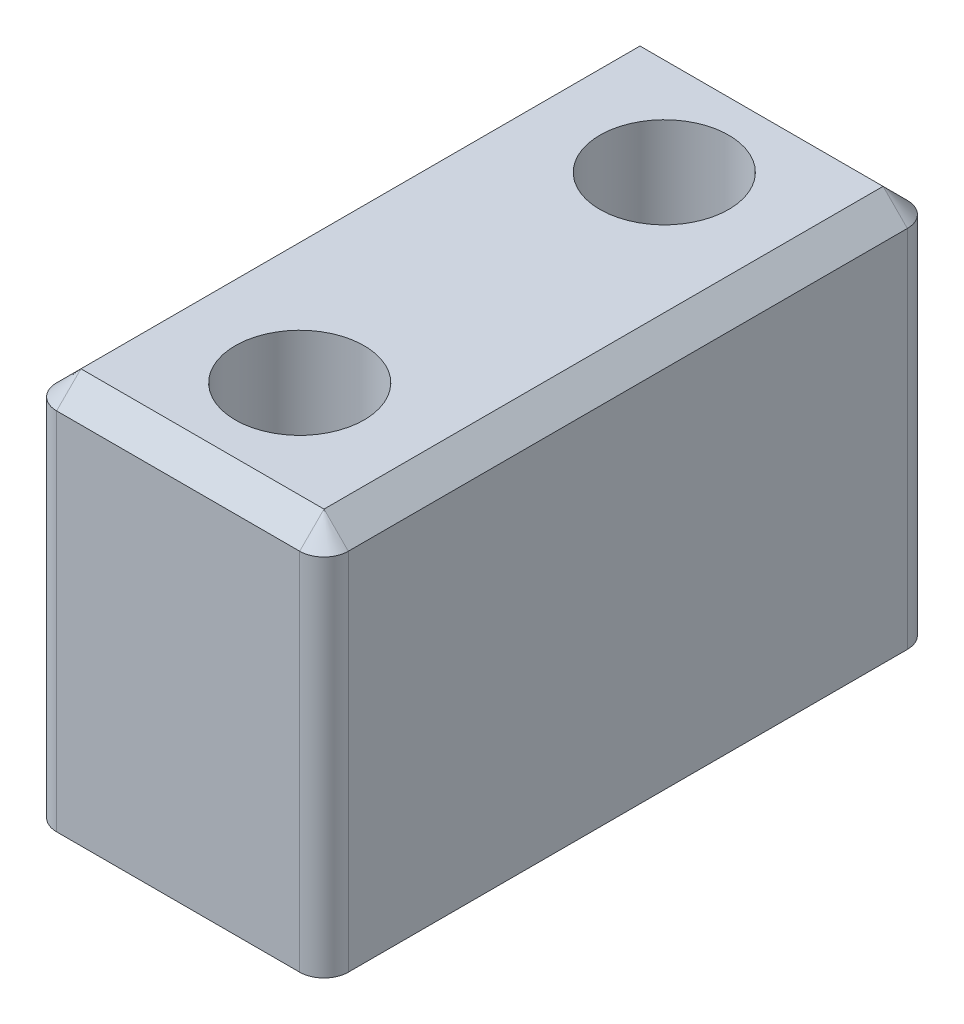
from build123d import *

# Parameters (mm, degrees)
SKETCH1_W           = 12
SKETCH1_H           = 25
SKETCH1_R           = 2.65
BOSS_EXTRUDE1_DEPTH = 8
FILLET1_R           = 1
CHAMFER1_SIZE       = 1


with BuildPart() as part:
    # Sketch1 → Boss-Extrude1 (new, symmetric)
    with BuildSketch(Plane(origin=(0, 0, 0), x_dir=(1, 0, 0), z_dir=(0, 1, 0))):
        Rectangle(SKETCH1_W, SKETCH1_H)
        with Locations((0, 7.5)):
            Circle(SKETCH1_R, mode=Mode.SUBTRACT)
        with Locations((0, -7.5)):
            Circle(SKETCH1_R, mode=Mode.SUBTRACT)
    extrude(amount=BOSS_EXTRUDE1_DEPTH, both=True)

    # Fillet1
    fillet1_edges = [part.edges().sort_by_distance(p)[0] for p in [
        (-6, 0, 12.5),
        (-6, 0, -12.5),
        (6, 0, -12.5),
        (6, 0, 12.5),
    ]]
    fillet(fillet1_edges, radius=FILLET1_R)

    # Chamfer1
    chamfer1_edges = [part.edges().sort_by_distance(p)[0] for p in [
        (0, 8, -12.5),
        (-5.707106781, 8, -12.207106781),
        (5.707106781, 8, -12.207106781),
        (-6, 8, 0),
        (6, 8, 0),
        (-5.707106781, 8, 12.207106781),
        (5.707106781, 8, 12.207106781),
        (0, 8, 12.5),
    ]]
    chamfer(chamfer1_edges, length=CHAMFER1_SIZE)


solid = part.part
